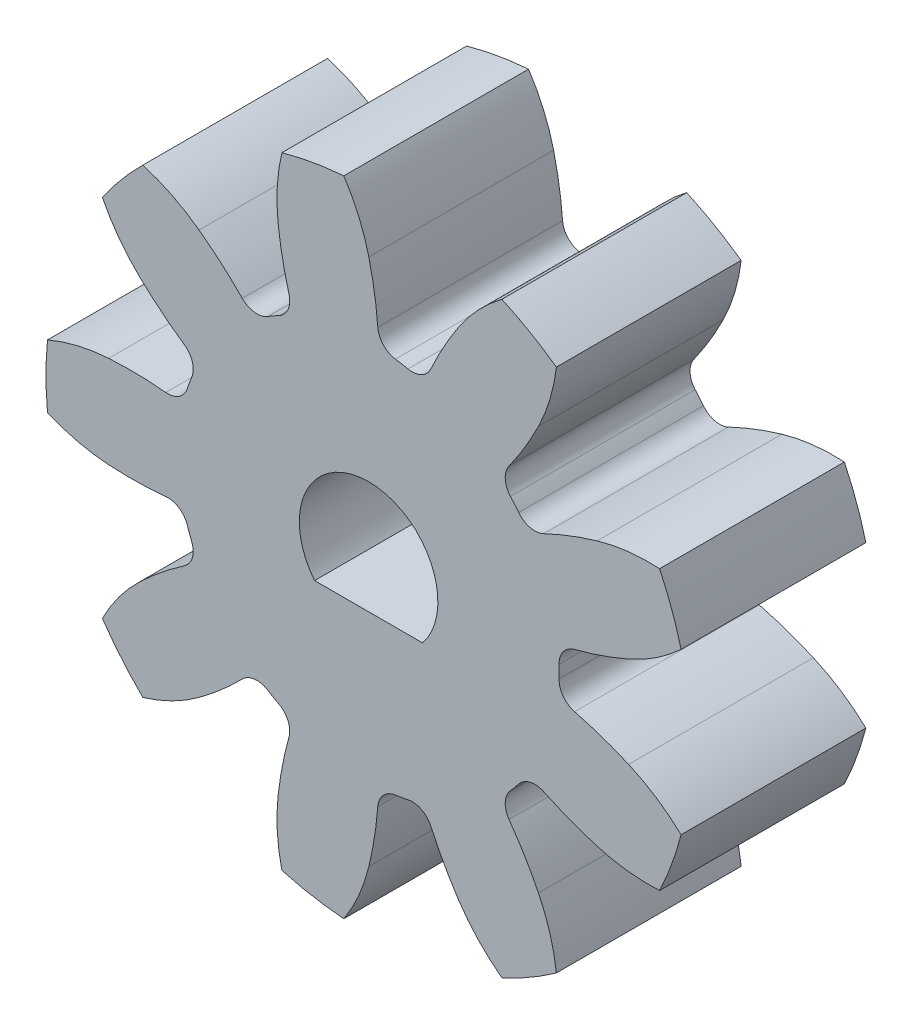
from build123d import *

# Parameters (mm, degrees)
SKETCH1_R                = 6.985
BLANK_DISK_DEPTH         = 2.000000064
GEAR_TOOTH_CUT_DEPTH     = 11.657412961
GEAR_TEETH_REVOLVE_COUNT = 9
SKETCH4_R                = 0.75
HUB_EXTRUDE_DEPTH        = 0.635
HEX_BORE_CUT_DEPTH       = 11.643895353
HEX_BORE_CUT_DEPTH_BACK  = 11.643895353


with BuildPart() as part:
    # Sketch1 → BLANK DISK (new, symmetric)
    with BuildSketch(Plane.XY):
        Circle(SKETCH1_R)
    extrude(amount=BLANK_DISK_DEPTH, both=True)

    # Sketch2 → GEAR TOOTH CUT (cut, through all)
    with BuildSketch(Plane.XY.offset(2.000000064)):
        with BuildLine():
            ThreePointArc((-5.763009467, -3.946890786), (-6.563752956, -2.389010701), (-6.951733872, -0.680897326))
            ThreePointArc((-6.951733872, -0.680897326), (-6.303106227, -0.89616004), (-5.627259472, -0.997585))
            ThreePointArc((-5.627259472, -0.997585), (-5.00805343, -1.01182167), (-4.389706578, -0.976241119))
            ThreePointArc((-4.389706578, -0.976241119), (-4.103194142, -1.046520353), (-3.923782009, -1.280699416))
            ThreePointArc((-3.923782009, -1.280699416), (-3.878581292, -1.411688142), (-3.82900912, -1.541085788))
            ThreePointArc((-3.82900912, -1.541085788), (-3.815919388, -1.835801253), (-3.990226026, -2.073804914))
            ThreePointArc((-3.990226026, -2.073804914), (-4.486777934, -2.444014326), (-4.951966126, -2.852938219))
            ThreePointArc((-4.951966126, -2.852938219), (-5.404500069, -3.365060167), (-5.763009467, -3.946890786))
        make_face()
    gear_tooth_cut = extrude(amount=-GEAR_TOOTH_CUT_DEPTH, mode=Mode.SUBTRACT)

    # GEAR TEETH REVOLVE: GEAR TOOTH CUT ×9 about axis
    gear_teeth_revolve_axis = Axis((0, 0, 50), (0, 0, -1))
    for i in range(1, GEAR_TEETH_REVOLVE_COUNT):
        add(gear_tooth_cut.rotate(gear_teeth_revolve_axis, i * 360 / GEAR_TEETH_REVOLVE_COUNT), mode=Mode.SUBTRACT)

    # Sketch4 → Hub Extrude (add)
    with BuildSketch(Plane.XY.offset(2.000000064)):
        Circle(SKETCH4_R)
    extrude(amount=HUB_EXTRUDE_DEPTH)

    # Sketch3 → HEX BORE CUT (cut, two sides: drawn at the far end of the back side and taken through both)
    with BuildSketch(Plane.XY.offset(2.000000064).offset(-HEX_BORE_CUT_DEPTH_BACK)):
        with BuildLine():
            Line((-1.168931136, -0.94), (1.168931136, -0.94))
            ThreePointArc((1.168931136, -0.94), (0, 1.5), (-1.168931136, -0.94))
        make_face()
    extrude(amount=HEX_BORE_CUT_DEPTH + HEX_BORE_CUT_DEPTH_BACK, mode=Mode.SUBTRACT)


solid = part.part
